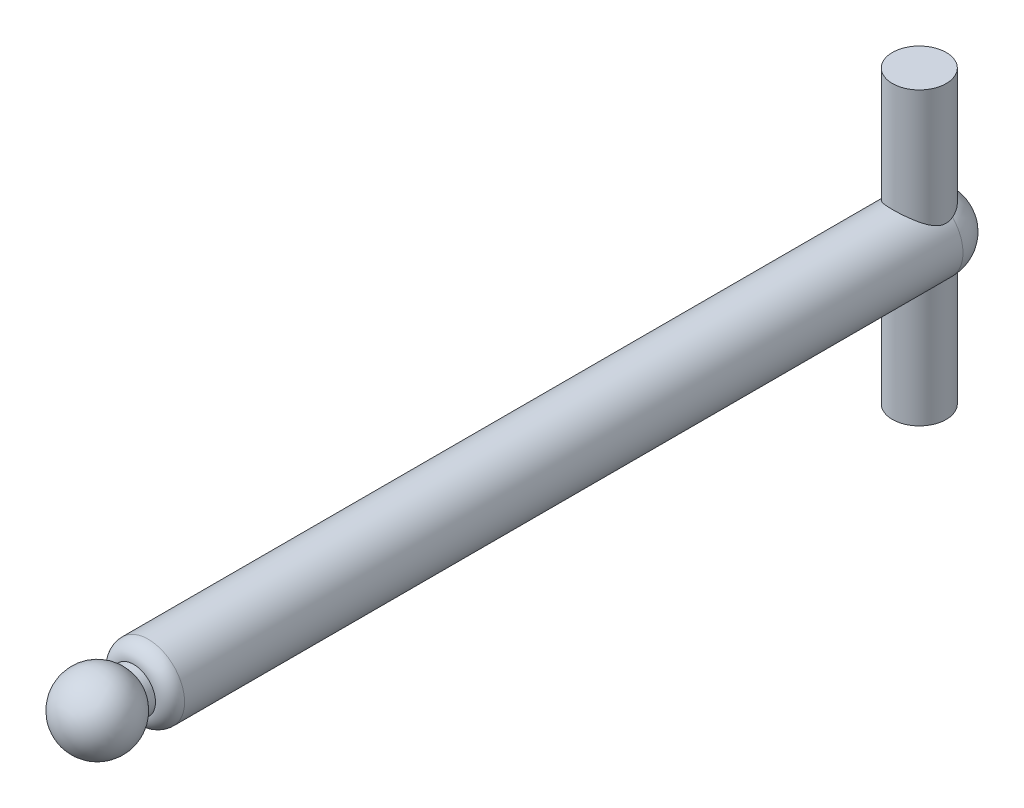
from build123d import *

# Parameters (mm, degrees)
SKETCH1_R                = 2.5
BOSS_EXTRUDE1_DEPTH      = 57
SKETCH3_W                = 1.5
SKETCH3_H                = 3.627330444
FILLET1_R                = 1
BOSS_EXTRUDE2_DEPTH      = 10
BOSS_EXTRUDE2_DEPTH_BACK = 10
SKETCH4_R                = 1.85
FILLET2_R                = 2.5


with BuildPart() as part:
    # Sketch1 → Boss-Extrude1 (new body)
    with BuildSketch(Plane.XY):
        with Locations(Location((0, 0, 0), (0, 0, 180))):
            Circle(SKETCH1_R)
    extrude(amount=BOSS_EXTRUDE1_DEPTH)

    # Fillet1
    fillet1_edges = [part.edges().sort_by_distance(p)[0] for p in [
        (2.5, 0, 57),
    ]]
    fillet(fillet1_edges, radius=FILLET1_R)

    # Sketch4 → Boss-Extrude2 (add, two sides: drawn at the far end of the back side and taken through both)
    with BuildSketch(Plane(origin=(0, 0, 0), x_dir=(1, 0, 0), z_dir=(0, 1, 0)).offset(-BOSS_EXTRUDE2_DEPTH_BACK)):
        with Locations(Location((0, -3, 0), (0, 0, 270))):
            Circle(SKETCH4_R)
    extrude(amount=BOSS_EXTRUDE2_DEPTH + BOSS_EXTRUDE2_DEPTH_BACK)

    # Fillet2
    # the kernel refuses this fillet: 2.5 mm, written as the material it takes off along each edge
    with BuildSketch(Plane(origin=(0, 0, 0), x_dir=(-1, 0, 0), z_dir=(0, 1, 0))) as fillet2_piece_1_section:
        with BuildLine():
            CenterArc((2.5 - FILLET2_R, FILLET2_R), FILLET2_R, 270, 90)
            Line((2.5 - FILLET2_R, 0), (2.5, 0))
            Line((2.5, 0), (2.5, FILLET2_R))
        make_face()
    fillet2_piece_1 = revolve(axis=Axis((0, 0, 0), (0, 0, 1)), mode=Mode.PRIVATE)
    fillet2_piece_1 = fillet2_piece_1 - Plane(origin=(0, 0, 3), x_dir=(0, 0, 1), z_dir=(0, -1, 0)) * Cylinder(1.85, 10, mode=Mode.PRIVATE)
    add(fillet2_piece_1, mode=Mode.SUBTRACT)


with BuildPart() as body_2:
    # Sketch3 → Revolve1 (revolve)
    with BuildSketch(Plane(origin=(0, 0, 0), x_dir=(1, 0, 0), z_dir=(0, 1, 0)), mode=Mode.PRIVATE) as revolve1_sk:
        with BuildLine():
            Line((0, -57), (0, -62))
            ThreePointArc((0, -62), (-2.5, -59.5), (0, -57))
        make_face()
        with Locations((-0.75, -56.562735647)):
            Rectangle(SKETCH3_W, SKETCH3_H)
    revolve(revolve1_sk.sketch.rotate(Axis((0, 0, 57), (0, 0, 1)), 180), axis=Axis((0, 0, 57), (0, 0, 1)))


solid = Compound([part.part, body_2.part])
